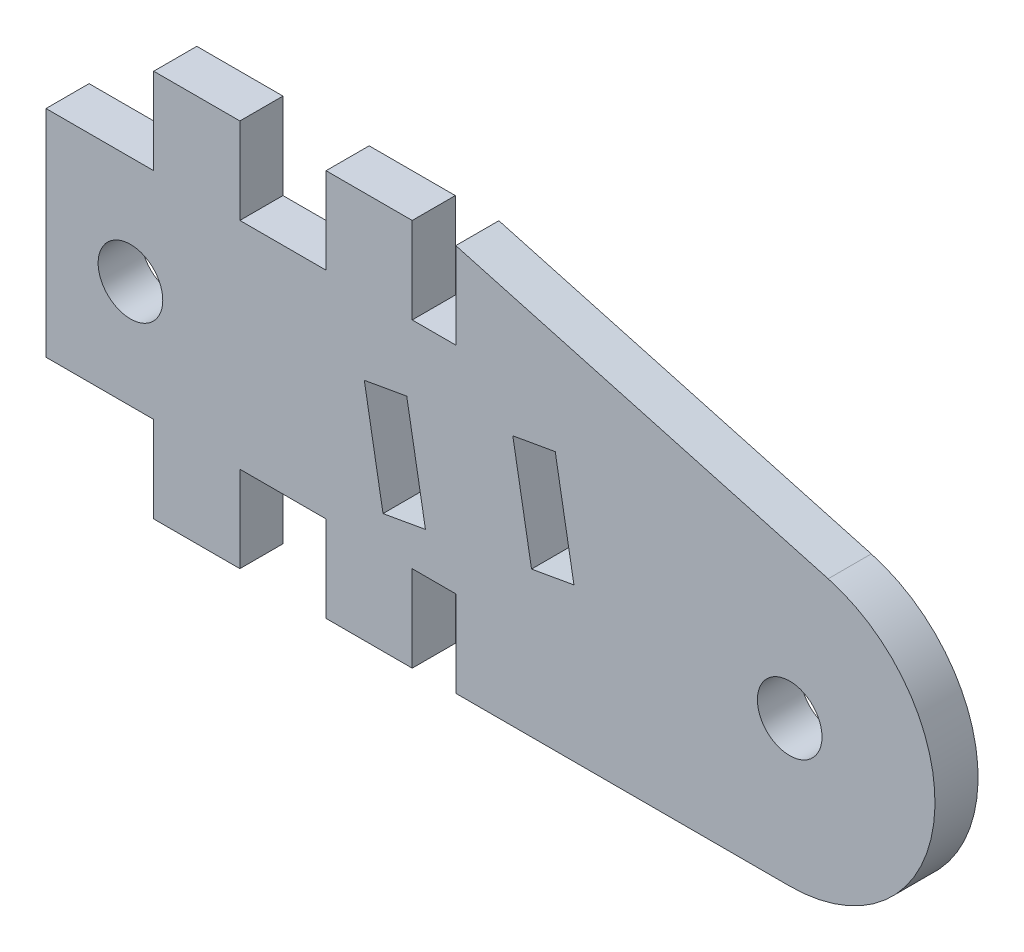
from build123d import *

# Parameters (mm, degrees)
SKETCH1_R           = 1.5
BOSS_EXTRUDE1_DEPTH = 2


with BuildPart() as part:
    # Sketch1 → Boss-Extrude1 (new body)
    with BuildSketch(Plane.XY):
        with BuildLine():
            Line((3.92, 0), (7.92, 0))
            Line((7.92, 0), (7.92, 4))
            Line((7.92, 4), (11.92, 4))
            Line((11.92, 4), (11.92, 0))
            Line((11.92, 0), (15.92, 0))
            Line((15.92, 0), (15.92, 4))
            Line((15.92, 4), (17.941516349, 4))
            Line((17.941516349, 4), (17.941516349, 0))
            Line((17.941516349, 0), (33.441500418, 0))
            ThreePointArc((33.441500418, 0), (40.126296361, 5.843591176), (35.228815729, 13.249584567))
            Line((35.228815729, 13.249584567), (17.941561934, 17.999988357))
            Line((17.941561934, 17.999988357), (17.941561934, 14))
            Line((17.941561934, 14), (15.92, 14))
            Line((15.92, 14), (15.92, 18))
            Line((15.92, 18), (11.92, 18))
            Line((11.92, 18), (11.92, 14))
            Line((11.92, 14), (7.92, 14))
            Line((7.92, 14), (7.92, 18))
            Line((7.92, 18), (3.92, 18))
            Line((3.92, 18), (3.92, 14))
            Line((3.92, 14), (-1.08, 14))
            Line((-1.08, 14), (-1.08, 4))
            Line((-1.08, 4), (3.92, 4))
            Line((3.92, 4), (3.92, 0))
        make_face()
        with Locations((2.840490093, 9)):
            Circle(SKETCH1_R, mode=Mode.SUBTRACT)
        with Locations((33.441500418, 6.745343083)):
            Circle(SKETCH1_R, mode=Mode.SUBTRACT)
        Polygon((22.559149333, 12.024852982), (20.589533827, 11.677556626), (21.457774715, 6.753517861), (23.427390221, 7.100814216), align=None, mode=Mode.SUBTRACT)
        Polygon((15.665495062, 10.809315738), (16.53373595, 5.885276973), (14.564120444, 5.537980617), (13.695879556, 10.462019383), align=None, mode=Mode.SUBTRACT)
    extrude(amount=BOSS_EXTRUDE1_DEPTH)


solid = part.part
